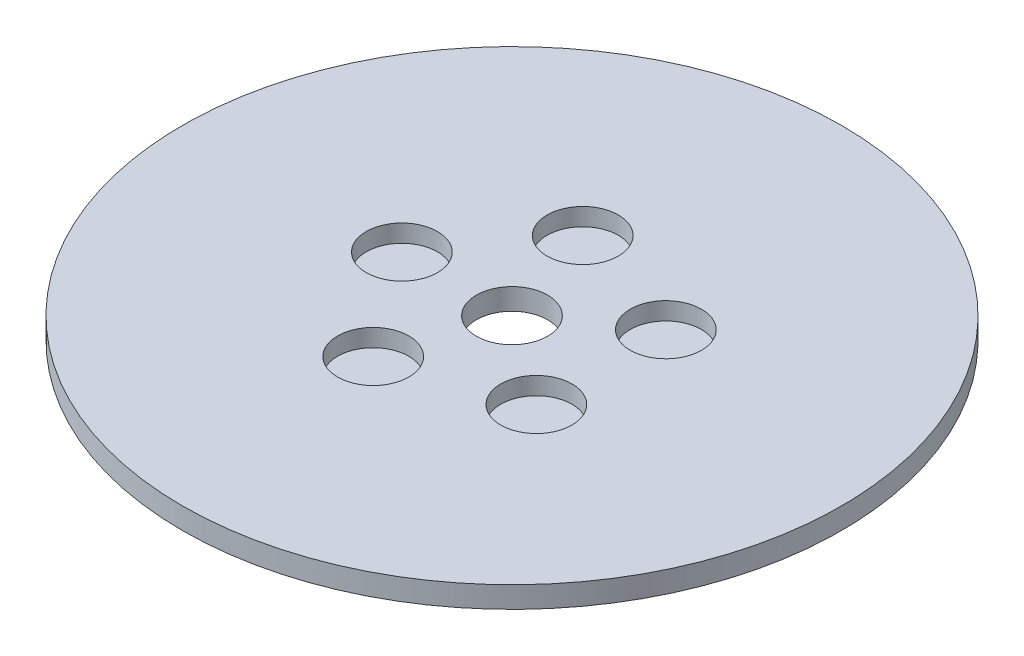
from build123d import *

# Parameters (mm, degrees)
SKETCH1_R           = 92.5
BOSS_EXTRUDE1_DEPTH = 6
SKETCH2_R           = 10
CUT_EXTRUDE1_DEPTH  = 131.952281385
SKETCH3_R           = 10
CUT_EXTRUDE2_DEPTH  = 4.941973012
CIRPATTERN1_COUNT   = 5


with BuildPart() as part:
    # Sketch1 → Boss-Extrude1 (new body)
    with BuildSketch(Plane(origin=(0, 0, 0), x_dir=(1, 0, 0), z_dir=(0, 1, 0))):
        Circle(SKETCH1_R)
    extrude(amount=BOSS_EXTRUDE1_DEPTH)

    # Sketch2 → Cut-Extrude1 (cut, through all)
    with BuildSketch(Plane(origin=(0, 0, 0), x_dir=(1, 0, 0), z_dir=(0, 1, 0))):
        Circle(SKETCH2_R)
    extrude(amount=CUT_EXTRUDE1_DEPTH, mode=Mode.SUBTRACT)

    # Sketch3 → Cut-Extrude2 (cut)
    with BuildSketch(Plane(origin=(0, 6, 0), x_dir=(1, 0, 0), z_dir=(0, 1, 0))):
        with Locations((-30.914776162, 0)):
            Circle(SKETCH3_R)
    cut_extrude2 = extrude(amount=-CUT_EXTRUDE2_DEPTH, mode=Mode.SUBTRACT)

    # CirPattern1: Cut-Extrude2 ×5 about axis
    cirpattern1_axis = Axis((0, 0, 0), (0, 1, 0))
    for i in range(1, CIRPATTERN1_COUNT):
        add(cut_extrude2.rotate(cirpattern1_axis, i * 360 / CIRPATTERN1_COUNT), mode=Mode.SUBTRACT)


solid = part.part
